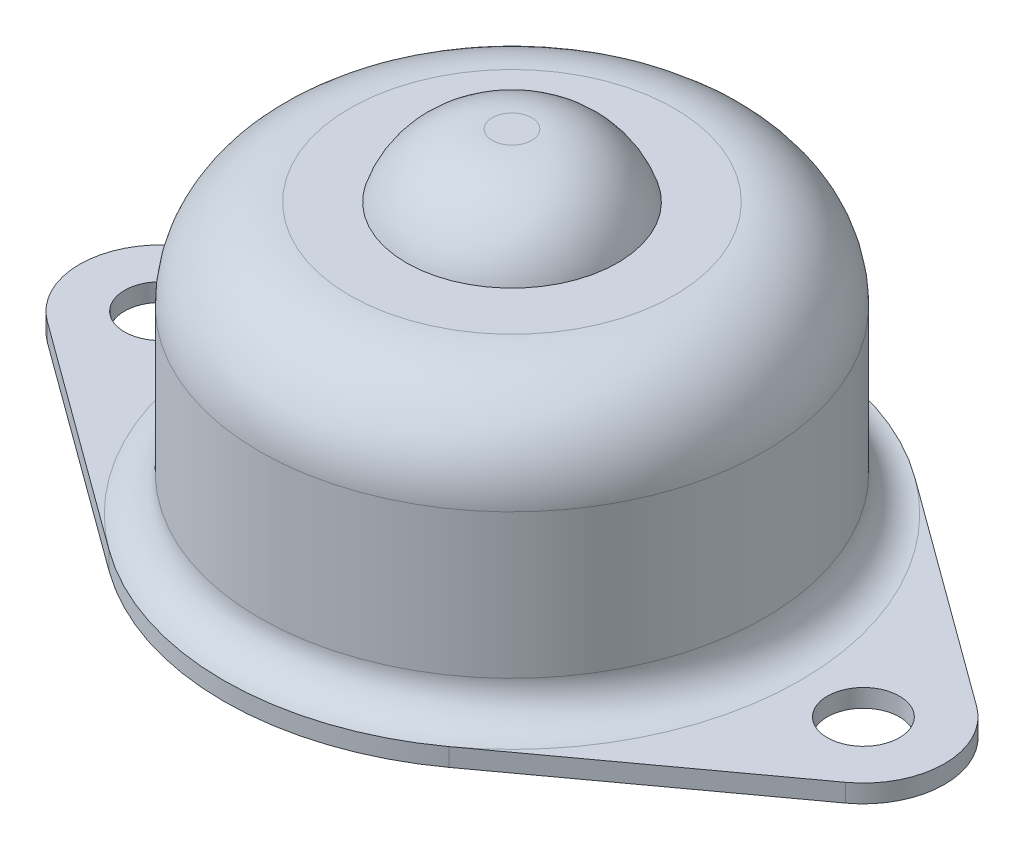
from build123d import *

# Parameters (mm, degrees)
SKETCH1_R           = 2
BOSS_EXTRUDE1_DEPTH = 1
SKETCH2_R           = 14
BOSS_EXTRUDE2_DEPTH = 15
FILLET1_R           = 5
SKETCH3_R           = 5.863522808
BOSS_EXTRUDE3_DEPTH = 3.5
FILLET2_R           = 5
FILLET3_R           = 2


# Some blends are built 0.0001 mm under size
with BuildPart() as part:
    # Sketch1 → Boss-Extrude1 (new body)
    with BuildSketch(Plane(origin=(0, 0, 0), x_dir=(1, 0, 0), z_dir=(0, 1, 0))):
        with BuildLine():
            Line((-22.153846154, 3.63415748), (-9.435897436, 12.921448819))
            ThreePointArc((-9.435897436, 12.921448819), (0, 16), (9.435897436, 12.921448819))
            Line((9.435897436, 12.921448819), (22.153846154, 3.63415748))
            ThreePointArc((22.153846154, 3.63415748), (24, 0), (22.153846154, -3.63415748))
            Line((22.153846154, -3.63415748), (9.435897436, -12.921448819))
            ThreePointArc((9.435897436, -12.921448819), (0, -16), (-9.435897436, -12.921448819))
            Line((-9.435897436, -12.921448819), (-22.153846154, -3.63415748))
            ThreePointArc((-22.153846154, -3.63415748), (-24, 0), (-22.153846154, 3.63415748))
        make_face()
        with Locations(Location((19.5, 0, 0), (0, 0, 270))):
            Circle(SKETCH1_R, mode=Mode.SUBTRACT)
        with Locations(Location((-19.5, 0, 0), (0, 0, 270))):
            Circle(SKETCH1_R, mode=Mode.SUBTRACT)
    extrude(amount=BOSS_EXTRUDE1_DEPTH)

    # Sketch2 → Boss-Extrude2 (add)
    with BuildSketch(Plane(origin=(0, 1, 0), x_dir=(1, 0, 0), z_dir=(0, 1, 0))):
        with Locations(Location((0, 0, 0), (0, 0, 270))):
            Circle(SKETCH2_R)
    extrude(amount=BOSS_EXTRUDE2_DEPTH)

    # Fillet1
    fillet1_edges = [part.edges().sort_by_distance(p)[0] for p in [
        (0, 16, -14),
    ]]
    fillet(fillet1_edges, radius=FILLET1_R)

    # Sketch3 → Boss-Extrude3 (add)
    with BuildSketch(Plane(origin=(0, 16, 0), x_dir=(1, 0, 0), z_dir=(0, 1, 0))):
        with Locations(Location((0, 0, 0), (0, 0, 270))):
            Circle(SKETCH3_R)
    extrude(amount=BOSS_EXTRUDE3_DEPTH)

    # Fillet2
    # the kernel refuses this fillet: 5 mm, written as the material it takes off along each edge
    with BuildSketch(Plane(origin=(0, 19.5, 0), x_dir=(0, 0, 1), z_dir=(-1, 0, 0))) as fillet2_piece_1:
        with BuildLine():
            CenterArc((1.093826801, -5), FILLET2_R, 17.457603124, 72.542396876)
            Line((1.093826801, 0), (1.093826801, 0.1))
            Line((1.093826801, 0.1), (5.863522808, 0.1))
            Line((5.863522808, 0.1), (5.963522808, 0))
            ThreePointArc((5.963522808, 0), (5.963522808, -1.75), (5.958916728, -3.47))
            Line((5.958916728, -3.47), (5.863522808, -3.5))
        make_face()
    revolve(axis=Axis((0, 19.5, 0), (0, 1, 0)), mode=Mode.SUBTRACT)

    # Fillet3
    fillet3_edges = [part.edges().sort_by_distance(p)[0] for p in [
        (0, 1, -14),
    ]]
    fillet(fillet3_edges, radius=FILLET3_R - 0.0001)  # a hair under: the kernel refuses the full size


solid = part.part
